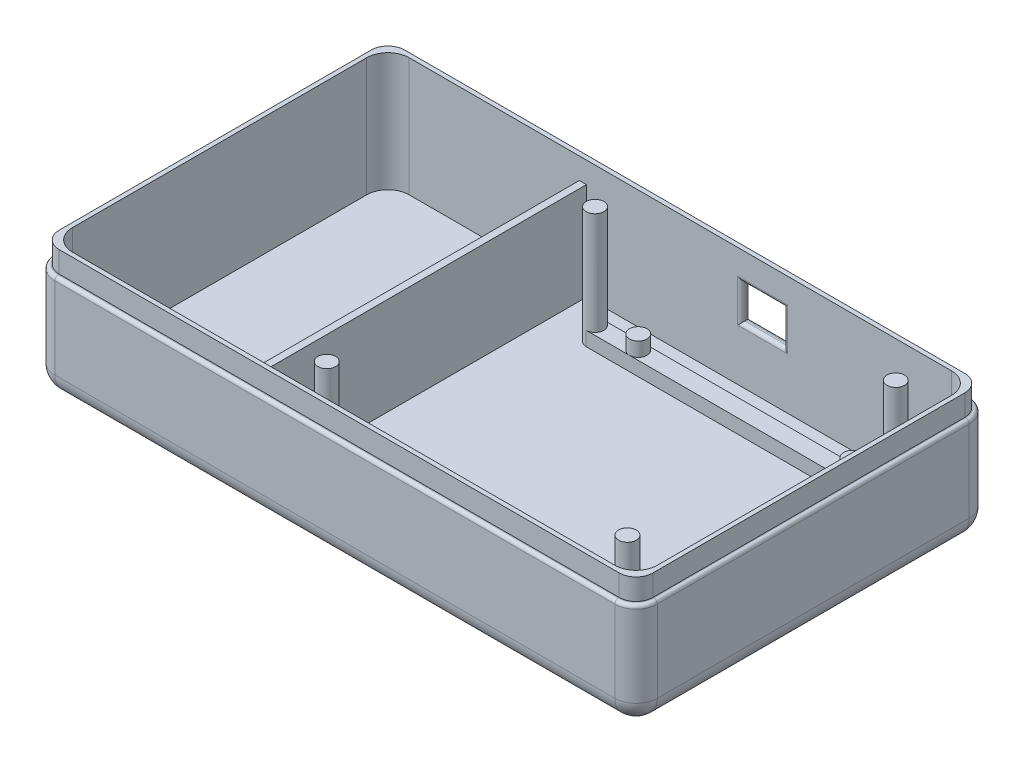
from build123d import *

# Parameters (mm, degrees)
SKETCH2_W           = 54.5
SKETCH2_H           = 47.5
SKETCH2_W_2         = 1
SKETCH2_W_3         = 27
BOSS_EXTRUDE3_DEPTH = 1.25
SKETCH2_4_W         = 85
SKETCH2_4_H         = 50
SKETCH2_4_W_2       = 82.5
SKETCH2_4_H_2       = 47.5
BOSS_EXTRUDE4_DEPTH = 18
SKETCH2_5_W         = 1
SKETCH2_5_H         = 47.5
BOSS_EXTRUDE5_DEPTH = 15
SKETCH5_R           = 1.2446
BOSS_EXTRUDE6_DEPTH = 16.5
SKETCH6_R           = 1.2446
BOSS_EXTRUDE7_DEPTH = 4
SKETCH7_W           = 42.418
SKETCH7_H           = 2.4892
BOSS_EXTRUDE9_DEPTH = 2
FILLET2_R           = 3
SKETCH10_OUTSIDE_W  = 107.048
SKETCH10_OUTSIDE_H  = 72.048
CUT_EXTRUDE4_DEPTH  = 3
FILLET3_R           = 0.5
SKETCH14_W          = 6
SKETCH14_H          = 5
CUT_EXTRUDE5_DEPTH  = 2
FILLET4_R           = 0.5


with BuildPart() as part:
    # Sketch2 → Boss-Extrude3 (new body)
    with BuildSketch(Plane(origin=(0, 0, 0), x_dir=(1, 0, 0), z_dir=(0, 1, 0))):
        with Locations((14, 0)):
            Rectangle(SKETCH2_W, SKETCH2_H)
        with Locations((-13.75, 0)):
            Rectangle(SKETCH2_W_2, SKETCH2_H)
        with Locations((-27.75, 0)):
            Rectangle(SKETCH2_W_3, SKETCH2_H)
    extrude(amount=BOSS_EXTRUDE3_DEPTH)

    # Sketch2<4> → Boss-Extrude4 (add)
    with BuildSketch(Plane(origin=(0, 0, 0), x_dir=(1, 0, 0), z_dir=(0, 1, 0))):
        Rectangle(SKETCH2_4_W, SKETCH2_4_H)
        Rectangle(SKETCH2_4_W_2, SKETCH2_4_H_2, mode=Mode.SUBTRACT)
    extrude(amount=BOSS_EXTRUDE4_DEPTH)

    # Sketch2<5> → Boss-Extrude5 (add)
    with BuildSketch(Plane(origin=(0, 0, 0), x_dir=(1, 0, 0), z_dir=(0, 1, 0))):
        with Locations((-13.75, 0)):
            Rectangle(SKETCH2_5_W, SKETCH2_5_H)
    extrude(amount=BOSS_EXTRUDE5_DEPTH)

    # Sketch5 → Boss-Extrude6 (add)
    with BuildSketch(Plane(origin=(0, 1.25, 0), x_dir=(1, 0, 0), z_dir=(0, 1, 0))):
        with Locations(Location((-7.209, 18.923, 0), (0, 0, 270))):
            Circle(SKETCH5_R)
        with Locations(Location((35.209, 18.923, 0), (0, 0, 270))):
            Circle(SKETCH5_R)
        with Locations(Location((-7.209, -18.923, 0), (0, 0, 270))):
            Circle(SKETCH5_R)
        with Locations(Location((35.209, -18.923, 0), (0, 0, 270))):
            Circle(SKETCH5_R)
    extrude(amount=BOSS_EXTRUDE6_DEPTH)

    # Sketch6 → Boss-Extrude7 (add)
    with BuildSketch(Plane(origin=(0, 1.25, 0), x_dir=(1, 0, 0), z_dir=(0, 1, 0))):
        with Locations(Location((-1.113, 18.923, 0), (0, 0, 270))):
            Circle(SKETCH6_R)
        with Locations(Location((29.113, 18.923, 0), (0, 0, 270))):
            Circle(SKETCH6_R)
        with Locations(Location((-1.113, -18.923, 0), (0, 0, 270))):
            Circle(SKETCH6_R)
        with Locations(Location((29.113, -18.923, 0), (0, 0, 270))):
            Circle(SKETCH6_R)
    extrude(amount=BOSS_EXTRUDE7_DEPTH)

    # Sketch7 → Boss-Extrude9 (add)
    with BuildSketch(Plane(origin=(0, 1.25, 0), x_dir=(1, 0, 0), z_dir=(0, 1, 0))):
        with Locations((14, -18.923)):
            Rectangle(SKETCH7_W, SKETCH7_H)
        with Locations((14, 18.923)):
            Rectangle(SKETCH7_W, SKETCH7_H)
    extrude(amount=BOSS_EXTRUDE9_DEPTH)

    # Fillet2
    fillet2_edges = [part.edges().sort_by_distance(p)[0] for p in [
        (41.25, 9.625, 23.75),
        (-41.25, 9.625, 23.75),
        (-41.25, 9.625, -23.75),
        (0, 0, 25),
        (-42.5, 9, 25),
        (42.5, 0, 0),
        (42.5, 9, 25),
        (42.5, 9, -25),
        (-42.5, 9, -25),
        (41.25, 9.625, -23.75),
        (-42.5, 0, 0),
        (0, 0, -25),
    ]]
    fillet(fillet2_edges, radius=FILLET2_R)

    # Sketch10 outside → Cut-Extrude4 (cut)
    with BuildSketch(Plane(origin=(0, 18, 0), x_dir=(1, 0, 0), z_dir=(0, 1, 0))):
        Rectangle(SKETCH10_OUTSIDE_W, SKETCH10_OUTSIDE_H)
        with BuildLine():
            Line((-41.875, 22), (-41.875, -22))
            ThreePointArc((-41.875, -22), (-41.179378605, -23.679378605), (-39.5, -24.375))
            Line((-39.5, -24.375), (39.5, -24.375))
            ThreePointArc((39.5, -24.375), (41.179378605, -23.679378605), (41.875, -22))
            Line((41.875, -22), (41.875, 22))
            ThreePointArc((41.875, 22), (41.179378605, 23.679378605), (39.5, 24.375))
            Line((39.5, 24.375), (-39.5, 24.375))
            ThreePointArc((-39.5, 24.375), (-41.179378605, 23.679378605), (-41.875, 22))
        make_face(mode=Mode.SUBTRACT)
    extrude(amount=-CUT_EXTRUDE4_DEPTH, mode=Mode.SUBTRACT)

    # Fillet3
    fillet3_edges = [part.edges().sort_by_distance(p)[0] for p in [
        (41.621320344, 15, -24.121320344),
        (0, 15, 25),
        (42.5, 15, 0),
        (-41.621320344, 15, 24.121320344),
        (-42.5, 15, 0),
        (-41.621320344, 15, -24.121320344),
        (0, 15, -25),
        (41.621320344, 15, 24.121320344),
    ]]
    fillet(fillet3_edges, radius=FILLET3_R)

    # Sketch14 → Cut-Extrude5 (cut)
    with BuildSketch(Plane.XY.offset(-25)):
        with Locations((11.587, 11.5)):
            Rectangle(SKETCH14_W, SKETCH14_H)
    extrude(amount=CUT_EXTRUDE5_DEPTH, mode=Mode.SUBTRACT)

    # Fillet4
    fillet4_edges = [part.edges().sort_by_distance(p)[0] for p in [
        (8.587, 11.5, -23.75),
        (11.587, 9, -23.75),
        (14.587, 11.5, -25),
        (11.587, 14, -25),
        (14.587, 11.5, -23.75),
        (11.587, 14, -23.75),
        (8.587, 11.5, -25),
        (11.587, 9, -25),
    ]]
    fillet(fillet4_edges, radius=FILLET4_R - 0.0001)  # a hair under: the kernel refuses the full size


solid = part.part
